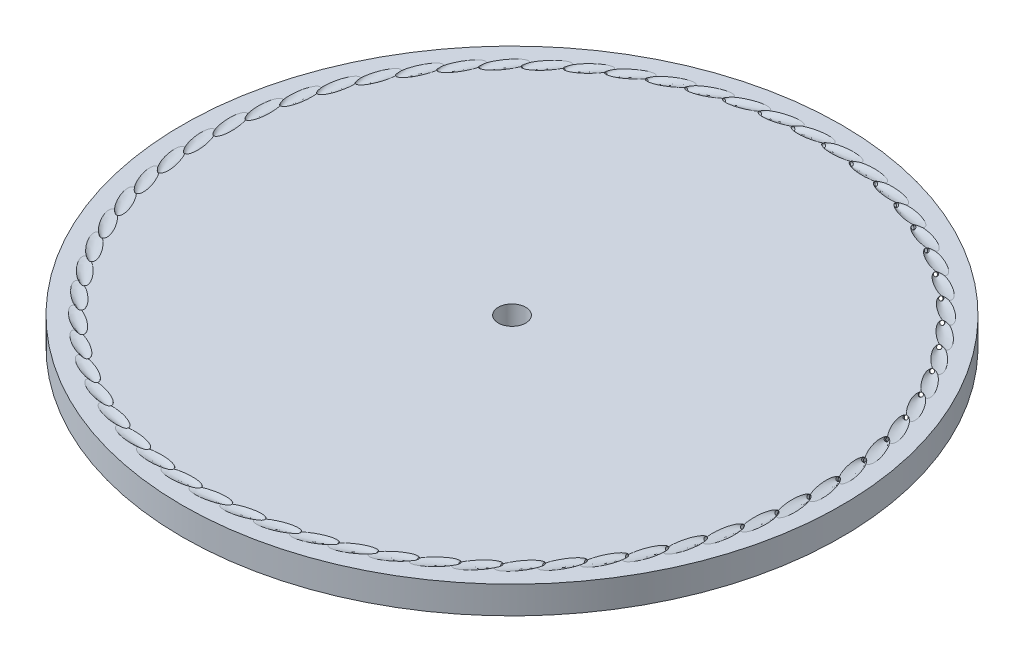
from build123d import *

# Parameters (mm, degrees)
SKETCH1_R           = 152.4
SKETCH1_R_2         = 6.35
BOSS_EXTRUDE1_DEPTH = 12.7
CIRPATTERN1_COUNT   = 64


with BuildPart() as part:
    # Sketch1 → Boss-Extrude1 (new body)
    with BuildSketch(Plane(origin=(0, 0, 0), x_dir=(1, 0, 0), z_dir=(0, 1, 0))):
        Circle(SKETCH1_R)
        Circle(SKETCH1_R_2, mode=Mode.SUBTRACT)
    extrude(amount=BOSS_EXTRUDE1_DEPTH)

    # Sketch2 → Cut-Revolve8 (revolve, cut)
    with BuildSketch(Plane.XY.offset(139.7)):
        Polygon((5.827451335, -16.010790957), (11.432889595, -8.005395478), (-28.493440084, 19.951321536), (-33.570870086, 12.7), (-17.629865999, 11.305342857), (-16.329462128, 10.394790264), align=None)
    cut_revolve8 = revolve(axis=Axis((11.432889595, -8.005395478, 139.7), (-0.8191520442889932, 0.5735764363510439, 0)), mode=Mode.SUBTRACT)

    # CirPattern1: Cut-Revolve8 ×64 about axis
    cirpattern1_axis = Axis((0, 12.7, 0), (0, -1, 0))
    for i in range(1, CIRPATTERN1_COUNT):
        add(cut_revolve8.rotate(cirpattern1_axis, i * 360 / CIRPATTERN1_COUNT), mode=Mode.SUBTRACT)


solid = part.part
